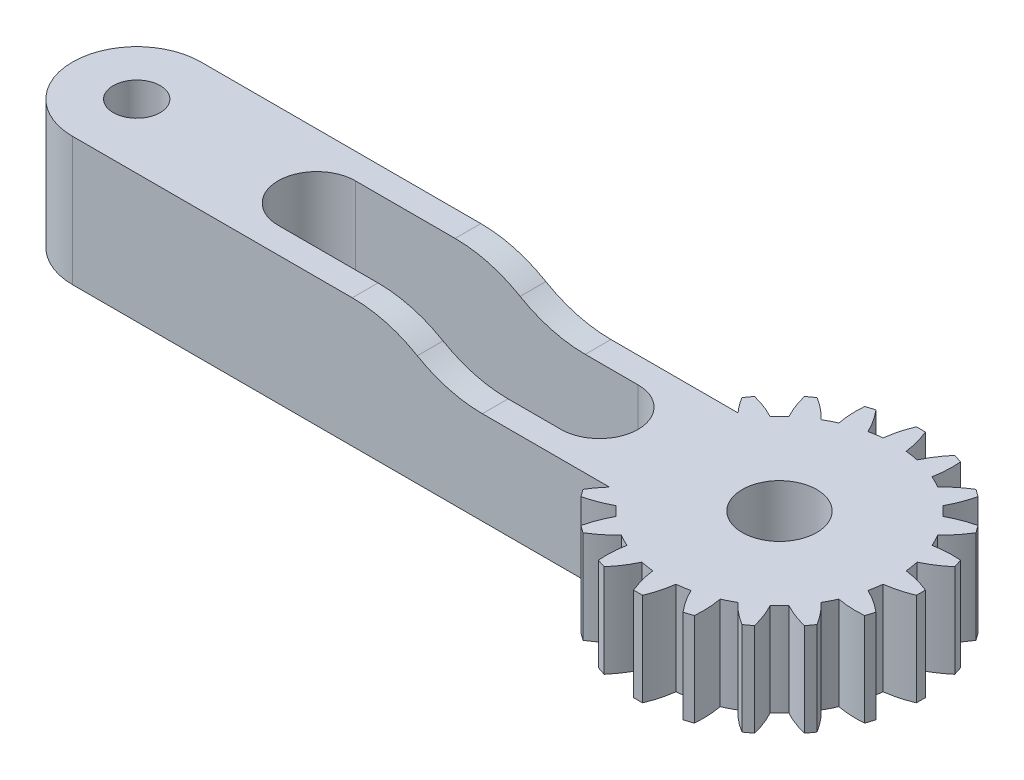
from build123d import *

# Parameters (mm, degrees)
SKIZZE2_R                       = 1.825
SKIZZE2_R_2                     = 2.9
AUFSATZ_LINEAR_AUSTRAGEN1_DEPTH = 10
SCHNITT_LINEAR_START            = -2.75
SCHNITT_LINEAR_AUSTRAGEN1_DEPTH = 2.75
VERRUNDUNG1_R                   = 10
VERRUNDUNG2_R                   = 10
AUFSATZ_LINEAR_START            = -7.25
SKIZZE5_R                       = 9
SKIZZE5_R_2                     = 5
AUFSATZ_LINEAR_AUSTRAGEN2_DEPTH = 7.25
AUFSATZ_LINEAR_AUSTRAGEN3_DEPTH = 7.25
KREISMUSTER1_COUNT              = 20
SCHNITT_LINEAR_AUSTRAGEN3_DEPTH = 39.948684188


with BuildPart() as part:
    # Skizze2 → Aufsatz-Linear austragen1 (new body)
    with BuildSketch(Plane(origin=(0, 0, 0), x_dir=(1, 0, 0), z_dir=(0, 1, 0))):
        with BuildLine():
            Line((-25, 5), (25, 5))
            ThreePointArc((25, 5), (30, 0), (25, -5))
            Line((25, -5), (-25, -5))
            ThreePointArc((-25, -5), (-30, 0), (-25, 5))
        make_face()
        with Locations(Location((-25, 0, 0), (0, 0, 270))):
            Circle(SKIZZE2_R, mode=Mode.SUBTRACT)
        with Locations(Location((25, 0, 0), (0, 0, 270))):
            Circle(SKIZZE2_R_2, mode=Mode.SUBTRACT)
    extrude(amount=AUFSATZ_LINEAR_AUSTRAGEN1_DEPTH)

    # Skizze4 → Schnitt-Linear austragen1 (cut)
    with BuildSketch(Plane(origin=(0, 10, 0), x_dir=(1, 0, 0), z_dir=(0, 1, 0)).offset(SCHNITT_LINEAR_START)):
        with BuildLine():
            Line((25, 5), (0, 5))
            Line((0, 5), (0, -5))
            Line((0, -5), (25, -5))
            ThreePointArc((25, -5), (30, 0), (25, 5))
        make_face()
    extrude(amount=SCHNITT_LINEAR_AUSTRAGEN1_DEPTH, mode=Mode.SUBTRACT)

    # Verrundung1
    # the kernel refuses this fillet: 10 mm, written as the material it adds along each edge
    with BuildSketch(Plane(origin=(0, 7.25, -5), x_dir=(1, 0, 0), z_dir=(0, 0, 1))) as verrundung1_piece_1:
        with BuildLine():
            CenterArc((6.887488657, 10), VERRUNDUNG1_R, 226.468847833, 43.531152167)
            Line((0, 2.75), (-0.137749773, 2.605))
            ThreePointArc((-0.137749773, 2.605), (-0.2, 1.375), (-0.2, 0))
            Line((-0.2, 0), (0, -0.2))
            Line((0, -0.2), (6.887488657, -0.2))
            Line((6.887488657, -0.2), (6.887488657, 0))
        make_face()
    extrude(amount=10)

    # Verrundung2
    verrundung2_edges = [part.edges().sort_by_distance(p)[0] for p in [
        (0, 10, 0),
    ]]
    fillet(verrundung2_edges, radius=VERRUNDUNG2_R)

    # Skizze5 → Aufsatz-Linear austragen2 (add)
    with BuildSketch(Plane(origin=(0, 7.25, 0), x_dir=(1, 0, 0), z_dir=(0, 1, 0)).offset(AUFSATZ_LINEAR_START)):
        with Locations((25, 0)):
            Circle(SKIZZE5_R)
        with Locations((25, 0)):
            Circle(SKIZZE5_R_2, mode=Mode.SUBTRACT)
    extrude(amount=AUFSATZ_LINEAR_AUSTRAGEN2_DEPTH)

    # Skizze6 → Aufsatz-Linear austragen3 (add)
    with BuildSketch(Plane(origin=(0, 7.25, 0), x_dir=(1, 0, 0), z_dir=(0, 1, 0)).offset(AUFSATZ_LINEAR_START)):
        with BuildLine():
            Line((36, -0.35), (36, 0.35))
            ThreePointArc((36, 0.35), (34.995800842, 0.693259833), (33.954886934, 0.9))
            ThreePointArc((33.954886934, 0.9), (34, 0), (33.954886934, -0.9))
            ThreePointArc((33.954886934, -0.9), (34.995800842, -0.693259833), (36, -0.35))
        make_face()
    aufsatz_linear_austragen3 = extrude(amount=AUFSATZ_LINEAR_AUSTRAGEN3_DEPTH)

    # Kreismuster1: Aufsatz-Linear austragen3 ×20 about axis
    kreismuster1_axis = Axis((25, 0, 0), (0, 1, 0))
    for i in range(1, KREISMUSTER1_COUNT):
        add(aufsatz_linear_austragen3.rotate(kreismuster1_axis, i * 360 / KREISMUSTER1_COUNT))

    # Skizze9 → Schnitt-Linear austragen3 (cut, through all)
    with BuildSketch(Plane.XZ):
        with BuildLine():
            Line((-11, 3), (11, 3))
            ThreePointArc((11, 3), (14, 0), (11, -3))
            Line((11, -3), (-11, -3))
            ThreePointArc((-11, -3), (-14, 0), (-11, 3))
        make_face()
    extrude(amount=-SCHNITT_LINEAR_AUSTRAGEN3_DEPTH, mode=Mode.SUBTRACT)


solid = part.part
